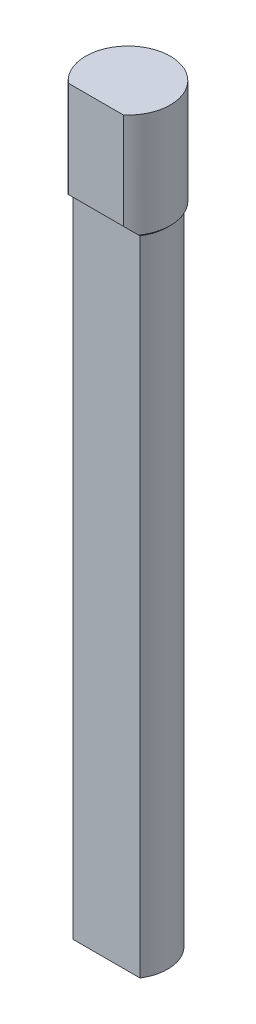
from build123d import *

# Parameters (mm, degrees)
BOSS_EXTRUDE1_DEPTH = 60
SKETCH2_W           = 1.5
SKETCH2_H           = 3.5
BOSS_EXTRUDE2_DEPTH = 0.7
SKETCH2_2_W         = 1.5
SKETCH2_2_H         = 3.5
BOSS_EXTRUDE3_DEPTH = 0.25
CHAMFER1_SIZE       = 0.6
CHAMFER2_SIZE       = 0.6
BOSS_EXTRUDE4_DEPTH = 10
CHAMFER3_SIZE       = 1
CHAMFER4_SIZE       = 0.25


with BuildPart() as part:
    # Sketch1 → Boss-Extrude1 (new body)
    with BuildSketch(Plane(origin=(0, 0, 0), x_dir=(1, 0, 0), z_dir=(0, 1, 0))):
        with BuildLine():
            Line((-3.112876483, -2), (3.112876483, -2))
            ThreePointArc((3.112876483, -2), (0, 3.7), (-3.112876483, -2))
        make_face()
    extrude(amount=BOSS_EXTRUDE1_DEPTH)



with BuildPart() as body_2:
    # Sketch2 → Boss-Extrude2 (new body)
    with BuildSketch(Plane(origin=(0, 0, -3.7), x_dir=(-1, 0, 0), z_dir=(0, 0, -1))):
        with Locations((0, 47.75)):
            Rectangle(SKETCH2_W, SKETCH2_H)
    extrude(amount=BOSS_EXTRUDE2_DEPTH)


with BuildPart() as part_1:
    add(part.part)

    add(body_2.part)  # Boss-Extrude3 merges body 2
    # Sketch2<2> → Boss-Extrude3 (add)
    with BuildSketch(Plane(origin=(0, 0, -3.7), x_dir=(-1, 0, 0), z_dir=(0, 0, -1))):
        with Locations((0, 47.75)):
            Rectangle(SKETCH2_2_W, SKETCH2_2_H)
    extrude(amount=-BOSS_EXTRUDE3_DEPTH)

    # Chamfer1
    chamfer1_edges = [part_1.edges().sort_by_distance(p)[0] for p in [
        (0, 49.5, -4.4),
    ]]
    chamfer(chamfer1_edges, length=CHAMFER1_SIZE)

    # Chamfer2
    chamfer2_edges = [part_1.edges().sort_by_distance(p)[0] for p in [
        (0, 46, -4.4),
    ]]
    chamfer(chamfer2_edges, length=CHAMFER2_SIZE)

    # Sketch3 → Boss-Extrude4 (add)
    with BuildSketch(Plane(origin=(0, 60, 0), x_dir=(1, 0, 0), z_dir=(0, 1, 0))):
        with BuildLine():
            Line((-2.569533032, -3), (2.569533032, -3))
            ThreePointArc((2.569533032, -3), (0, 3.95), (-2.569533032, -3))
        make_face()
    extrude(amount=BOSS_EXTRUDE4_DEPTH)

    # Chamfer3
    chamfer3_edges = [part_1.edges().sort_by_distance(p)[0] for p in [
        (0, 60, 3),
    ]]
    chamfer(chamfer3_edges, length=CHAMFER3_SIZE - 0.0001)  # a hair under: the kernel refuses the full size

    # Chamfer4
    chamfer4_edges = [part_1.edges().sort_by_distance(p)[0] for p in [
        (0, 60, -3.95),
    ]]
    chamfer(chamfer4_edges, length=CHAMFER4_SIZE - 0.0001)  # a hair under: the kernel refuses the full size


solid = part_1.part
